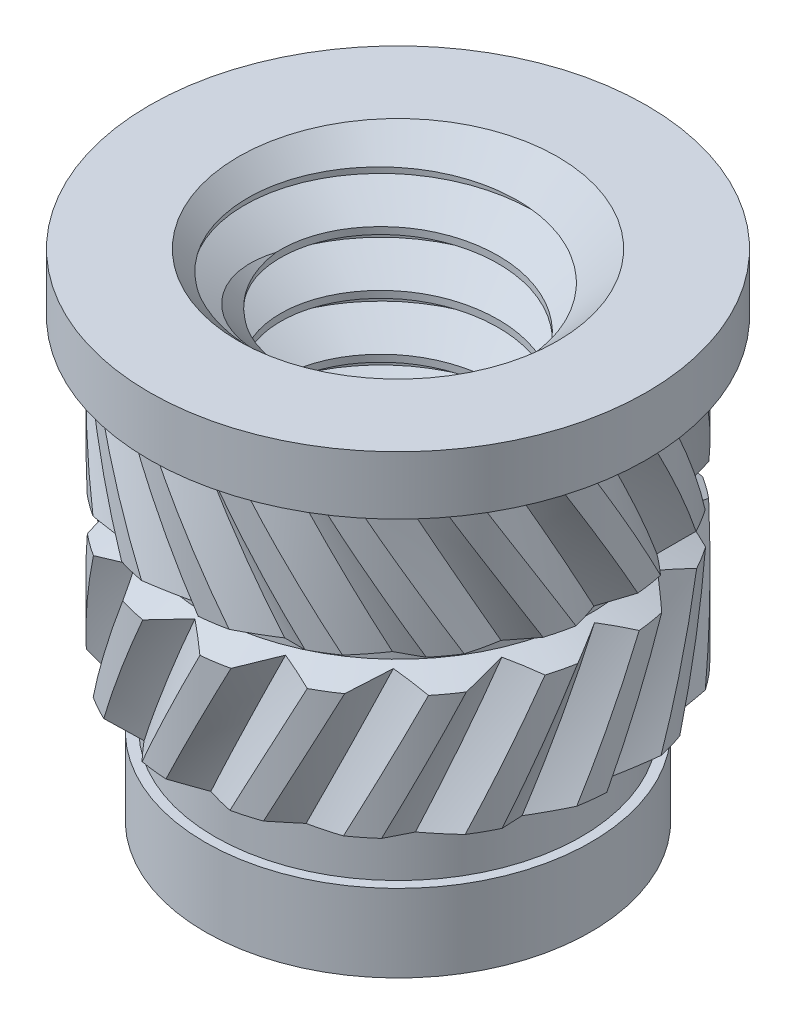
from build123d import *

# Parameters (mm, degrees)
SKETCH4_W              = 2.0828
SKETCH4_H              = 7.1882
CUT_SWEEP1_PITCH       = 0.79375
CUT_SWEEP1_HEIGHT      = 7.98195
CUT_SWEEP1_RADIUS      = 2.0828
CUT_SWEEP1_START_ANGLE = 90
SKETCH9_W              = 2.29108
SKETCH9_H              = 7.1882
CUT_SWEEP2_PITCH       = 34.036
CUT_SWEEP2_HEIGHT      = 2.12725
CUT_SWEEP2_RADIUS      = 3.16865
CUT_SWEEP2_START_ANGLE = 90
CUT_SWEEP3_PITCH       = 40.64
CUT_SWEEP3_HEIGHT      = 2.54
CUT_SWEEP3_RADIUS      = 3.16865
CUT_SWEEP3_START_ANGLE = 90
CIRPATTERN1_COUNT      = 16


with BuildPart() as part:
    # Sketch3 → Revolve1 (revolve)
    with BuildSketch(Plane.XY, mode=Mode.PRIVATE) as revolve1_sk:
        Polygon((-3.5687, 4.0132), (-3.5687, 3.175), (-2.7686, 3.175), (-2.7686, 2.936875), (-3.16865, 2.936875), (-3.16865, 1.1668125), (-2.7686, 0.989903597), (-2.7686, 0.867471403), (-3.16865, 0.6905625), (-3.16865, -1.0795), (-2.63017, -1.317625), (-2.63017, -1.9812), (-2.7686, -1.9812), (-2.7686, -3.095077402), (-2.63017, -3.175), (-2.29108, -3.175), (-2.0828, -2.96672), (-2.0828, 3.80492), (-2.29108, 4.0132), align=None)
    revolve(revolve1_sk.sketch.rotate(Axis((0, 4.0132, 0), (0, -1, 0)), 270), axis=Axis((0, 4.0132, 0), (0, -1, 0)))

    # Sketch9 → Revolve5 (revolve)
    with BuildSketch(Plane.XY):
        with Locations((-1.14554, 0.4191)):
            Rectangle(SKETCH9_W, SKETCH9_H)
    revolve(axis=Axis((0, 4.0132, 0), (0, -1, 0)))


with BuildPart() as body_2:
    # Sketch4 → Revolve2 (revolve)
    with BuildSketch(Plane.XY):
        with Locations((-1.0414, 0.4191)):
            Rectangle(SKETCH4_W, SKETCH4_H)
    revolve(axis=Axis((0, 4.0132, 0), (0, -1, 0)))

    # Cut-Sweep1: sweep along a helix
    with BuildLine() as cut_sweep1_path:
        add(Helix(CUT_SWEEP1_PITCH, CUT_SWEEP1_HEIGHT, CUT_SWEEP1_RADIUS, center=(0, -3.175, 0), direction=(0, 1, 0), mode=Mode.PRIVATE).rotate(Axis((0, -3.175, 0), (0, 1, 0)), CUT_SWEEP1_START_ANGLE))
    # Sketch6 → Cut-Sweep1 (sweep, cut)
    with BuildSketch(Plane.XY):
        Polygon((1.567244252, -3.47265625), (1.567244252, -3.571875), (2.125762979, -3.894335938), (2.168725958, -3.125390625), align=None)
    sweep(path=cut_sweep1_path.line, is_frenet=True, mode=Mode.SUBTRACT)

    # Sketch8 → Revolve4 (revolve)
    with BuildSketch(Plane.XY):
        Polygon((-2.29108, 4.0132), (0, 4.0132), (0, 1.72212), align=None)
    revolve(axis=Axis((0, 4.0132, 0), (0, -1, 0)))


with BuildPart() as part_1:
    add(part.part)

    # Combine1: cut body 2
    add(body_2.part, mode=Mode.SUBTRACT)

    # Sketch7 → Cut-Revolve1 (revolve, cut)
    with BuildSketch(Plane.XY):
        Polygon((-1.0414, -1.92532), (-1.0414, -3.175), (-2.29108, -3.175), (-2.450253333, -3.175), (-1.0414, -1.766146667), align=None)
    revolve(axis=Axis((0, -3.175, 0), (0, 1, 0)), mode=Mode.SUBTRACT)

    # Cut-Sweep2: sweep along a helix
    with BuildLine() as cut_sweep2_path:
        add(Helix(CUT_SWEEP2_PITCH, CUT_SWEEP2_HEIGHT, CUT_SWEEP2_RADIUS, center=(0, 0.9286875, 0), direction=(0, 1, 0), lefthand=True, mode=Mode.PRIVATE).rotate(Axis((0, 0.9286875, 0), (0, 1, 0)), CUT_SWEEP2_START_ANGLE))
    # Sketch12 → Cut-Sweep2 (sweep, cut)
    with BuildSketch(Plane(origin=(0, 0.9286875, 0), x_dir=(1, 0, 0), z_dir=(0, 1, 0))):
        with BuildLine():
            Line((2.8686125, 0), (3.221409828, 0.553780877))
            ThreePointArc((3.221409828, 0.553780877), (3.2686625, 0), (3.221409828, -0.553780877))
            Line((3.221409828, -0.553780877), (2.8686125, 0))
        make_face()
    cut_sweep2 = sweep(path=cut_sweep2_path.line, is_frenet=True, mode=Mode.SUBTRACT)

    # Cut-Sweep3: sweep along a helix
    with BuildLine() as cut_sweep3_path:
        add(Helix(CUT_SWEEP3_PITCH, CUT_SWEEP3_HEIGHT, CUT_SWEEP3_RADIUS, center=(0, 0.9286875, 0), direction=(0, -1, 0), mode=Mode.PRIVATE).rotate(Axis((0, 0.9286875, 0), (0, -1, 0)), CUT_SWEEP3_START_ANGLE))
    # Sketch13 → Cut-Sweep3 (sweep, cut)
    with BuildSketch(Plane(origin=(0, 0.9286875, 0), x_dir=(1, 0, 0), z_dir=(0, 1, 0))):
        with BuildLine():
            Line((2.8686125, 0), (3.221409828, 0.553780877))
            ThreePointArc((3.221409828, 0.553780877), (3.2686625, 0), (3.221409828, -0.553780877))
            Line((3.221409828, -0.553780877), (2.8686125, 0))
        make_face()
    cut_sweep3 = sweep(path=cut_sweep3_path.line, is_frenet=True, mode=Mode.SUBTRACT)

    # CirPattern1: Cut-Sweep2, Cut-Sweep3 ×16 about axis
    cirpattern1_axis = Axis((0, -3.175, 0), (0, 1, 0))
    add([cut_sweep2.rotate(cirpattern1_axis, i * 360 / CIRPATTERN1_COUNT) for i in range(1, CIRPATTERN1_COUNT)], mode=Mode.SUBTRACT)
    add([cut_sweep3.rotate(cirpattern1_axis, i * 360 / CIRPATTERN1_COUNT) for i in range(1, CIRPATTERN1_COUNT)], mode=Mode.SUBTRACT)


solid = part_1.part
